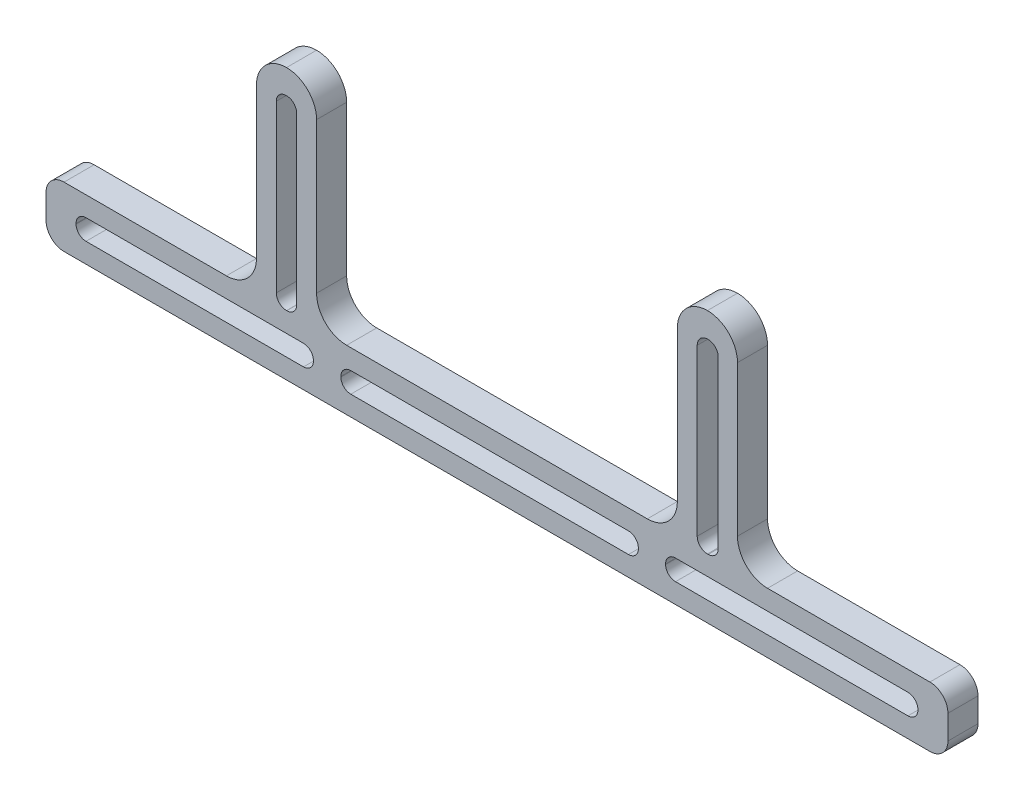
from build123d import *

# Parameters (mm, degrees)
EXTRUDE_1_DEPTH     = 5
FILLET_4_R          = 5
FILLET_5_R          = 5
FILLET_6_R          = 5
FILLET_7_R          = 5
FILLET_8_R          = 3
FILLET_9_R          = 3
FILLET_10_R         = 3
FILLET_11_R         = 3
FILLET_12_R         = 5
FILLET_13_R         = 5
FILLET_14_R         = 5
FILLET_15_R         = 5
CUT_EXTRUDE_START   = -5
CUT_EXTRUDE_2_DEPTH = 5


# Read off the part's stored shape, not the designer's step: 切除-拉伸2
with BuildPart() as part:
    # 草图1 → 凸台-拉伸1 (new body)
    with BuildSketch(Plane.XY):
        Polygon((-75, 5), (-40, 5), (-40, 40), (-30, 40), (-30, 5), (30, 5), (30, 40), (40, 40), (40, 5), (75, 5), (75, -5), (-75, -5), align=None)
    extrude(amount=EXTRUDE_1_DEPTH)

    # 圆角4
    fillet_4_edges = [part.edges().sort_by_distance(p)[0] for p in [
        (-40, 40, 2.5),
    ]]
    fillet(fillet_4_edges, radius=FILLET_4_R)

    # 圆角5
    fillet_5_edges = [part.edges().sort_by_distance(p)[0] for p in [
        (-30, 40, 2.5),
    ]]
    fillet(fillet_5_edges, radius=FILLET_5_R - 0.0001)  # a hair under: the kernel refuses the full size

    # 圆角6
    fillet_6_edges = [part.edges().sort_by_distance(p)[0] for p in [
        (30, 40, 2.5),
    ]]
    fillet(fillet_6_edges, radius=FILLET_6_R)

    # 圆角7
    fillet_7_edges = [part.edges().sort_by_distance(p)[0] for p in [
        (40, 40, 2.5),
    ]]
    fillet(fillet_7_edges, radius=FILLET_7_R - 0.0001)  # a hair under: the kernel refuses the full size

    # 圆角8
    fillet_8_edges = [part.edges().sort_by_distance(p)[0] for p in [
        (-75, 5, 2.5),
    ]]
    fillet(fillet_8_edges, radius=FILLET_8_R)

    # 圆角9
    fillet_9_edges = [part.edges().sort_by_distance(p)[0] for p in [
        (-75, -5, 2.5),
    ]]
    fillet(fillet_9_edges, radius=FILLET_9_R)

    # 圆角10
    fillet_10_edges = [part.edges().sort_by_distance(p)[0] for p in [
        (75, 5, 2.5),
    ]]
    fillet(fillet_10_edges, radius=FILLET_10_R)

    # 圆角11
    fillet_11_edges = [part.edges().sort_by_distance(p)[0] for p in [
        (75, -5, 2.5),
    ]]
    fillet(fillet_11_edges, radius=FILLET_11_R)

    # 圆角12
    fillet_12_edges = [part.edges().sort_by_distance(p)[0] for p in [
        (40, 5, 2.5),
    ]]
    fillet(fillet_12_edges, radius=FILLET_12_R)

    # 圆角13
    fillet_13_edges = [part.edges().sort_by_distance(p)[0] for p in [
        (30, 5, 2.5),
    ]]
    fillet(fillet_13_edges, radius=FILLET_13_R)

    # 圆角14
    fillet_14_edges = [part.edges().sort_by_distance(p)[0] for p in [
        (-30, 5, 2.5),
    ]]
    fillet(fillet_14_edges, radius=FILLET_14_R)

    # 圆角15
    fillet_15_edges = [part.edges().sort_by_distance(p)[0] for p in [
        (-40, 5, 2.5),
    ]]
    fillet(fillet_15_edges, radius=FILLET_15_R)

    # 切除-拉伸2 outline → 切除-拉伸2 (cut)
    with BuildSketch(Plane.XY.offset(5).offset(CUT_EXTRUDE_START)):
        with BuildLine():
            ThreePointArc((-36.7, 6.7), (-36.202081528, 5.497918472), (-35, 5))
            Line((-35, 5), (-34.95, 5))
            ThreePointArc((-34.95, 5), (-33.783273811, 5.483273811), (-33.3, 6.65))
            Line((-33.3, 6.65), (-33.3, 34.25))
            ThreePointArc((-33.3, 34.25), (-33.797918472, 35.452081528), (-35, 35.95))
            Line((-35, 35.95), (-35.05, 35.95))
            ThreePointArc((-35.05, 35.95), (-36.216726189, 35.466726189), (-36.7, 34.3))
            Line((-36.7, 34.3), (-36.7, 6.7))
        make_face()
        with BuildLine():
            Line((-30.527301477, -0.05), (-30.527301477, 0.05))
            ThreePointArc((-30.527301477, 0.05), (-31.010575288, 1.216726189), (-32.177301477, 1.7))
            Line((-32.177301477, 1.7), (-68.351867054, 1.699998944))
            ThreePointArc((-68.351867054, 1.699998944), (-69.517386106, 1.216065899), (-70, 0.05))
            Line((-70, 0.05), (-70, -0.05))
            ThreePointArc((-70, -0.05), (-69.516726189, -1.216726189), (-68.35, -1.7))
            Line((-68.35, -1.7), (-32.177301477, -1.7))
            ThreePointArc((-32.177301477, -1.7), (-31.010575288, -1.216726189), (-30.527301477, -0.05))
        make_face()
        with BuildLine():
            Line((-24.310810244, -1.7), (21.867276161, -1.7))
            ThreePointArc((21.867276161, -1.7), (23.03400235, -1.216726189), (23.517276161, -0.05))
            Line((23.517276161, -0.05), (23.517276161, 0.05))
            ThreePointArc((23.517276161, 0.05), (23.03400235, 1.216726189), (21.867276161, 1.7))
            Line((21.867276161, 1.7), (-24.310810244, 1.7))
            ThreePointArc((-24.310810244, 1.7), (-25.477536433, 1.216726189), (-25.960810244, 0.05))
            Line((-25.960810244, 0.05), (-25.960810244, -0.05))
            ThreePointArc((-25.960810244, -0.05), (-25.477536433, -1.216726189), (-24.310810244, -1.7))
        make_face()
        with BuildLine():
            Line((29.696775282, -1.7), (68.35, -1.7))
            ThreePointArc((68.35, -1.7), (69.516726189, -1.216726189), (70, -0.05))
            Line((70, -0.05), (70, 0.05))
            ThreePointArc((70, 0.05), (69.516726189, 1.216726189), (68.35, 1.7))
            Line((68.35, 1.7), (29.696775282, 1.7))
            ThreePointArc((29.696775282, 1.7), (28.530049093, 1.216726189), (28.046775282, 0.05))
            Line((28.046775282, 0.05), (28.046775282, -0.05))
            ThreePointArc((28.046775282, -0.05), (28.530049093, -1.216726189), (29.696775282, -1.7))
        make_face()
        with BuildLine():
            ThreePointArc((36.800022997, 34.2), (36.302104525, 35.402081528), (35.100022997, 35.9))
            Line((35.100022997, 35.9), (35.050022997, 35.9))
            ThreePointArc((35.050022997, 35.9), (33.812569868, 35.387430132), (33.3, 34.149977003))
            Line((33.3, 34.149977003), (33.3, 6.65))
            ThreePointArc((33.3, 6.65), (33.797918472, 5.447918472), (35, 4.95))
            Line((35, 4.95), (35.150022997, 4.95))
            ThreePointArc((35.150022997, 4.95), (36.316749186, 5.433273812), (36.800022997, 6.6))
            Line((36.800022997, 6.6), (36.800022997, 34.2))
        make_face()
    extrude(amount=CUT_EXTRUDE_2_DEPTH, mode=Mode.SUBTRACT)


solid = part.part
